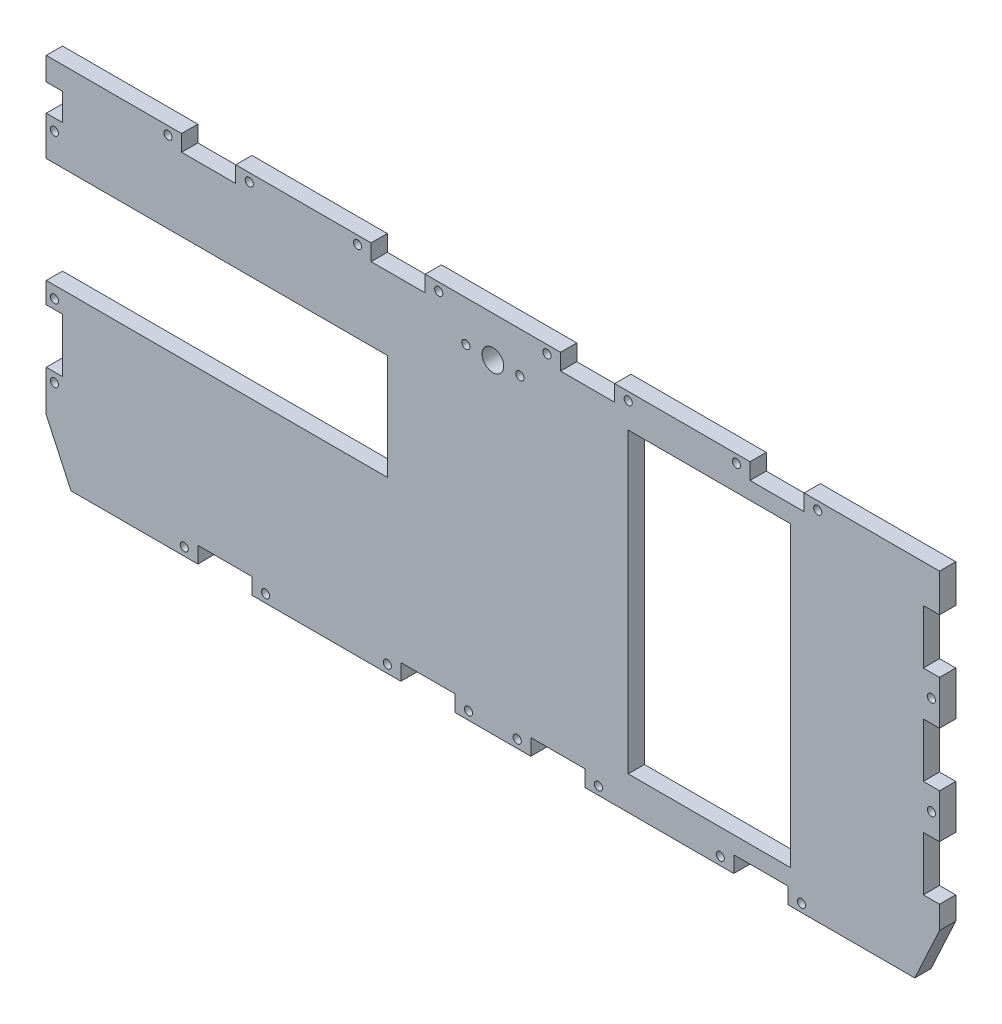
from build123d import *

# Parameters (mm, degrees)
BOSS_EXTRU_1_DEPTH      = 6
ESQUISSE3_W             = 6
ESQUISSE3_H             = 20
ESQUISSE3_H_2           = 10
ESQUISSE3_W_2           = 20
ESQUISSE3_H_3           = 6
ESQUISSE3_W_3           = 60
ESQUISSE3_H_4           = 110
ESQUISSE3_W_4           = 126
ESQUISSE3_H_5           = 39
ENL_V_MAT_EXTRU_2_DEPTH = 6
ESQUISSE4_R             = 1.5
ESQUISSE4_R_2           = 4
ENL_V_MAT_EXTRU_3_DEPTH = 6
ESQUISSE5_W             = 456.045253014
ESQUISSE5_H             = 136.228984631
ENL_V_MAT_EXTRU_4_DEPTH = 6


with BuildPart() as part:
    # Esquisse1 → Boss.-Extru.1 (new body)
    with BuildSketch(Plane.XY):
        Polygon((-165, 96.73), (165, 96.73), (165, -18.27), (123, -109.022410436), (-123, -109.022410436), (-165, -18.27), align=None)
    extrude(amount=BOSS_EXTRU_1_DEPTH)

    # Esquisse3 → Enlèv. mat.-Extru.2 (cut)
    with BuildSketch(Plane(origin=(0, 0, 0), x_dir=(-1, 0, 0), z_dir=(0, 0, -1))):
        with Locations((162, 6.94)):
            Rectangle(ESQUISSE3_W, ESQUISSE3_H)
        with Locations((162, 83.23258956)):
            Rectangle(ESQUISSE3_W, ESQUISSE3_H_2)
        with Locations((-24, -35.02)):
            Rectangle(ESQUISSE3_W_2, ESQUISSE3_H_3)
        with Locations((99, -35.02)):
            Rectangle(ESQUISSE3_W_2, ESQUISSE3_H_3)
        with Locations((-80, 29.355)):
            Rectangle(ESQUISSE3_W_3, ESQUISSE3_H_4)
        with Locations((-162, 72.73)):
            Rectangle(ESQUISSE3_W, ESQUISSE3_H)
        with Locations((24, -35.02)):
            Rectangle(ESQUISSE3_W_2, ESQUISSE3_H_3)
        with Locations((-162, 36.44)):
            Rectangle(ESQUISSE3_W, ESQUISSE3_H)
        with Locations((-162, 0.15)):
            Rectangle(ESQUISSE3_W, ESQUISSE3_H)
        with Locations((105, 93.73)):
            Rectangle(ESQUISSE3_W_2, ESQUISSE3_H_3)
        with Locations((-35, 93.73)):
            Rectangle(ESQUISSE3_W_2, ESQUISSE3_H_3)
        with Locations((35, 93.73)):
            Rectangle(ESQUISSE3_W_2, ESQUISSE3_H_3)
        with Locations((-105, 93.73)):
            Rectangle(ESQUISSE3_W_2, ESQUISSE3_H_3)
        with Locations((102, 44.23)):
            Rectangle(ESQUISSE3_W_4, ESQUISSE3_H_5)
        with Locations((-99, -35.02)):
            Rectangle(ESQUISSE3_W_2, ESQUISSE3_H_3)
    extrude(amount=-ENL_V_MAT_EXTRU_2_DEPTH, mode=Mode.SUBTRACT)

    # Esquisse4 → Enlèv. mat.-Extru.3 (cut)
    with BuildSketch(Plane(origin=(0, 0, 0), x_dir=(-1, 0, 0), z_dir=(0, 0, -1))):
        with Locations((162, 20.335)):
            Circle(ESQUISSE4_R)
        with Locations((114, -35.02)):
            Circle(ESQUISSE4_R)
        with Locations((162, 73.98258956)):
            Circle(ESQUISSE4_R)
        with Locations((84, -35.02)):
            Circle(ESQUISSE4_R)
        with Locations((39, -35.02)):
            Circle(ESQUISSE4_R)
        with Locations((162, -6.46)):
            Circle(ESQUISSE4_R)
        with Locations((9, -35.02)):
            Circle(ESQUISSE4_R)
        with Locations((-9, -35.02)):
            Circle(ESQUISSE4_R)
        with Locations((-39, -35.02)):
            Circle(ESQUISSE4_R)
        with Locations((-84, -35.02)):
            Circle(ESQUISSE4_R)
        with Locations((120, 93.73)):
            Circle(ESQUISSE4_R)
        with Locations((-114, -35.02)):
            Circle(ESQUISSE4_R)
        with Locations((90, 93.73)):
            Circle(ESQUISSE4_R)
        with Locations((0, 81.73)):
            Circle(ESQUISSE4_R_2)
        with Locations((50, 93.73)):
            Circle(ESQUISSE4_R)
        with Locations((20, 93.73)):
            Circle(ESQUISSE4_R)
        with Locations((-162, 18.29)):
            Circle(ESQUISSE4_R)
        with Locations((-162, 54.585)):
            Circle(ESQUISSE4_R)
        with Locations((-20, 93.73)):
            Circle(ESQUISSE4_R)
        with Locations((-50, 93.73)):
            Circle(ESQUISSE4_R)
        with Locations((-90, 93.73)):
            Circle(ESQUISSE4_R)
        with Locations((-120, 93.73)):
            Circle(ESQUISSE4_R)
        with Locations((-10, 81.73)):
            Circle(ESQUISSE4_R)
        with Locations((10, 81.73)):
            Circle(ESQUISSE4_R)
    extrude(amount=-ENL_V_MAT_EXTRU_3_DEPTH, mode=Mode.SUBTRACT)

    # Esquisse5 → Enlèv. mat.-Extru.4 (cut)
    with BuildSketch(Plane(origin=(0, 0, 0), x_dir=(-1, 0, 0), z_dir=(0, 0, -1))):
        with Locations((-18.307092018, -106.134492316)):
            Rectangle(ESQUISSE5_W, ESQUISSE5_H)
    extrude(amount=-ENL_V_MAT_EXTRU_4_DEPTH, mode=Mode.SUBTRACT)


solid = part.part
